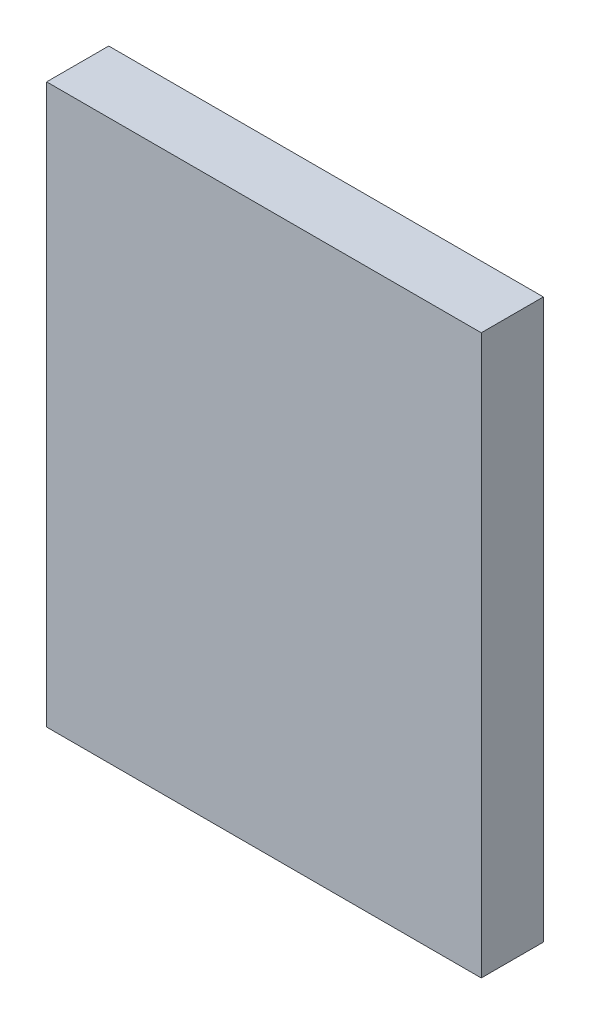
from build123d import *

# Parameters (mm, degrees)
SKETCH1_W           = 35
SKETCH1_H           = 45
BOSS_EXTRUDE1_DEPTH = 5


with BuildPart() as part:
    # Sketch1 → Boss-Extrude1 (new body)
    with BuildSketch(Plane.XY):
        with Locations((-2.113792049, -6.286739239)):
            Rectangle(SKETCH1_W, SKETCH1_H)
    extrude(amount=BOSS_EXTRUDE1_DEPTH)


solid = part.part
